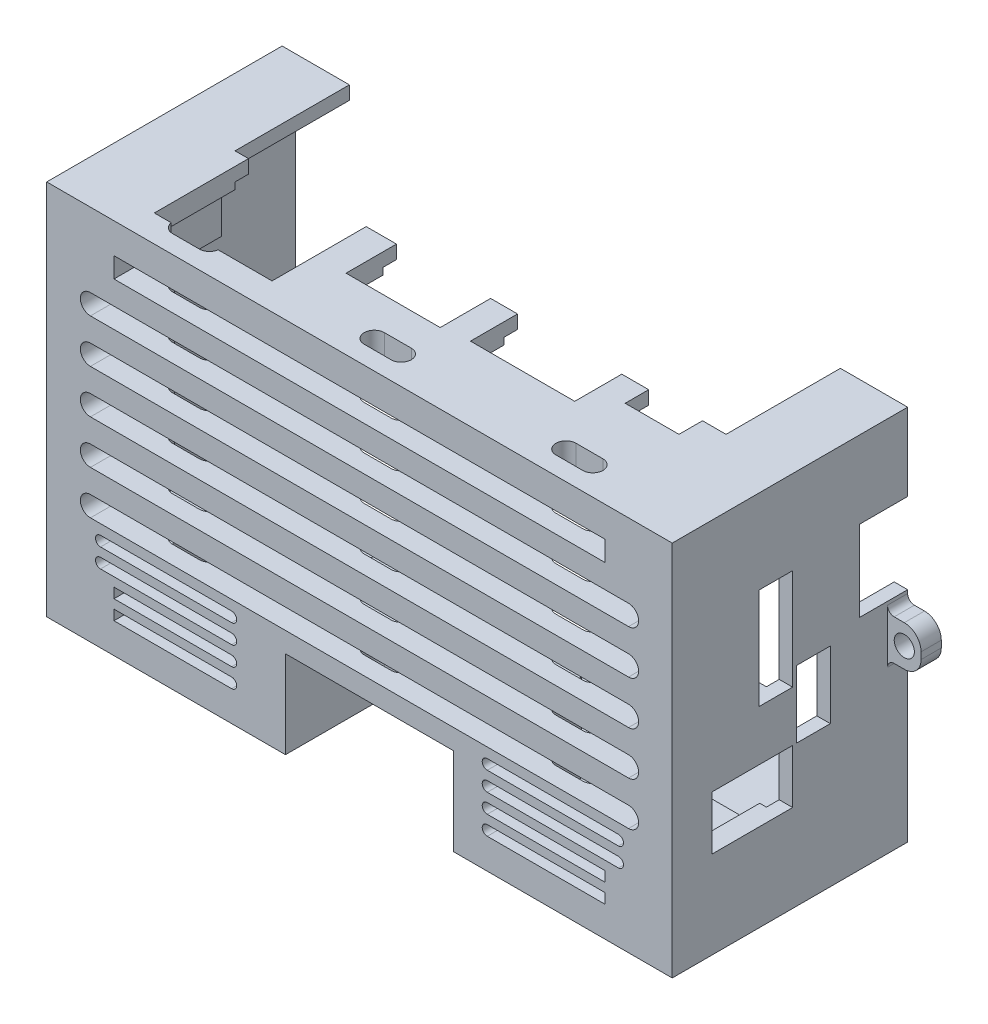
from build123d import *

# Parameters (mm, degrees)
EXTRUDE_1_DEPTH     = 35
CUT_EXTRUDE_1_DEPTH = 18
SKETCH_3_3_W        = 7
SKETCH_3_3_H        = 7
SKETCH_3_3_R        = 2
EXTRUDE_2_DEPTH     = 18
SKETCH_2_W          = 7
SKETCH_2_H          = 15.5
SKETCH_2_H_2        = 1.5
SKETCH_2_W_2        = 3
EXTRUDE_3_DEPTH     = 3
SKETCH_4_W          = 5
SKETCH_4_H          = 15
SKETCH_4_W_2        = 4
SKETCH_4_H_2        = 10
SKETCH_4_W_3        = 12
SKETCH_4_H_3        = 8
SKETCH_4_W_4        = 1
SKETCH_4_W_5        = 7.180640483
SKETCH_4_H_4        = 12
CUT_EXTRUDE_2_DEPTH = 3
CUT_EXTRUDE_START   = -16
SKETCH_3_5_W        = 7
SKETCH_3_5_H        = 7
SKETCH_3_5_R        = 2
CUT_EXTRUDE_3_DEPTH = 2
SKETCH_5_W          = 93
SKETCH_5_H          = 56
EXTRUDE_4_DEPTH     = 3
SKETCH_3_7_W        = 25
SKETCH_3_7_H        = 3
SKETCH_3_7_H_2      = 10
SKETCH_3_7_W_2      = 4
SKETCH_3_7_H_3      = 2.5
CUT_EXTRUDE_4_DEPTH = 18
SKETCH_6_W          = 73
SKETCH_6_H          = 3
CUT_EXTRUDE_5_DEPTH = 3
SKETCH_8_R          = 1.5
EXTRUDE_5_DEPTH     = 3
CUT_EXTRUDE_START_2 = -19
SKETCH_9_W          = 89
SKETCH_9_H          = 52
CUT_EXTRUDE_6_DEPTH = 19
CUT_EXTRUDE_7_DEPTH = 84.745149113
SKETCH_11_W         = 4
SKETCH_11_H         = 25
CUT_EXTRUDE_8_DEPTH = 6


with BuildPart() as part:
    # 草图1 → 凸台-拉伸1 (new body)
    with BuildSketch(Plane.XY):
        Polygon((-43.5, 18), (-46.5, 18), (-46.5, -18), (-43.5, -18), (-43.5, -17), (-43.5, 17), align=None)
        Polygon((-43.5, -18), (-46.5, -18), (-46.5, -28), (-36.5, -28), (-36.5, -25), (-43.5, -25), align=None)
        Polygon((46.5, -28), (46.5, -18), (43.5, -18), (43.5, -25), (36.5, -25), (36.5, -28), align=None)
        Polygon((46.5, -18), (46.5, 18), (43.5, 18), (43.5, 17), (43.5, -17), (43.5, -18), align=None)
        Polygon((-36.5, -25), (-36.5, -28), (36.5, -28), (36.5, -25), (35.5, -25), (23.25, -25), (-23.25, -25), (-35.5, -25), align=None)
        Polygon((-36.5, 28), (-46.5, 28), (-46.5, 18), (-43.5, 18), (-43.5, 25), (-36.5, 25), align=None)
        Polygon((46.5, 28), (36.5, 28), (36.5, 25), (43.5, 25), (43.5, 18), (46.5, 18), align=None)
    extrude(amount=EXTRUDE_1_DEPTH)

    # 草图3 → 切除-拉伸1 (cut)
    with BuildSketch(Plane.XY.offset(35)):
        Polygon((-46.5, -28), (-36.5, -28), (-36.5, -25), (-43.5, -25), (-43.5, -18), (-46.5, -18), align=None)
        Polygon((36.5, -25), (36.5, -28), (46.5, -28), (46.5, 18), (43.5, 18), (43.5, -25), align=None)
        Polygon((-43.5, 25), (-36.5, 25), (-36.5, 28), (-46.5, 28), (-46.5, 18), (-43.5, 18), align=None)
    extrude(amount=-CUT_EXTRUDE_1_DEPTH, mode=Mode.SUBTRACT)

    # 草图3<3> → 凸台-拉伸2 (add)
    # profile 1 of 9: a face of its own
    with BuildSketch(Plane.XY.offset(35)):
        with Locations((-40, 21.5)):
            Rectangle(SKETCH_3_3_W, SKETCH_3_3_H)
        with Locations((-39.5, 21)):
            Circle(SKETCH_3_3_R, mode=Mode.SUBTRACT)
    # profile 2 of 9: a face of its own
    with BuildSketch(Plane.XY.offset(35)):
        with Locations((-40, -21.5)):
            Rectangle(SKETCH_3_3_W, SKETCH_3_3_H)
        with Locations((-39.5, -21)):
            Circle(SKETCH_3_3_R, mode=Mode.SUBTRACT)
    # profile 3 of 9: a face of its own
    with BuildSketch(Plane.XY.offset(35)):
        with Locations((40, -21.5)):
            Rectangle(SKETCH_3_3_W, SKETCH_3_3_H)
        with Locations((39.5, -21)):
            Circle(SKETCH_3_3_R, mode=Mode.SUBTRACT)
    # profile 4 of 9: a face of its own
    with BuildSketch(Plane.XY.offset(35)):
        with Locations((40, 21.5)):
            Rectangle(SKETCH_3_3_W, SKETCH_3_3_H)
        with Locations((39.5, 21)):
            Circle(SKETCH_3_3_R, mode=Mode.SUBTRACT)
    # profile 5 of 9: a face of its own
    with BuildSketch(Plane.XY.offset(35)):
        Polygon((-46.5, -28), (-36.5, -28), (-36.5, -25), (-43.5, -25), (-43.5, -18), (-46.5, -18), align=None)
    # profile 6 of 9: a face of its own
    with BuildSketch(Plane.XY.offset(35)):
        Polygon((36.5, -25), (36.5, -28), (46.5, -28), (46.5, -18), (43.5, -18), (43.5, -25), align=None)
    # profile 7 of 9: a face of its own
    with BuildSketch(Plane.XY.offset(35)):
        Polygon((43.5, -18), (46.5, -18), (46.5, 18), (43.5, 18), (43.5, 17), (43.5, 15), (43.5, 1), (43.5, -7.5), (43.5, -14.5), (43.5, -17), align=None)
    # profile 8 of 9: a face of its own
    with BuildSketch(Plane.XY.offset(35)):
        Polygon((-43.5, 25), (-36.5, 25), (-36.5, 28), (-46.5, 28), (-46.5, 18), (-43.5, 18), align=None)
    # profile 9 of 9: a face of its own
    with BuildSketch(Plane.XY.offset(35)):
        Polygon((-11, -25), (-11, -15), (14, -15), (14, -25), (17, -25), (17, -12), (-14, -12), (-14, -25), align=None)
    extrude(amount=-EXTRUDE_2_DEPTH)

    # 草图2 → 凸台-拉伸3 (add)
    with BuildSketch(Plane(origin=(0, 28, 0), x_dir=(1, 0, 0), z_dir=(0, 1, 0))):
        Polygon((-43.5, -17), (-46.5, -17), (-46.5, -35), (36.5, -35), (36.5, -32.5), (-43.5, -32.5), align=None)
        Polygon((36.5, -32.5), (36.5, -17), (33, -17), (33, -20.5), (25, -20.5), (25, -17), (21, -17), (21, -24), (5.5, -24), (5.5, -17), (1.5, -17), (1.5, -24.5), (-12.5, -24.5), (-12.5, -17), (-17, -17), (-17, -31), (-34.5, -31), (-34.5, -17), (-43.5, -17), (-43.5, -32.5), align=None)
        Polygon((46.5, -35), (46.5, -17), (43.5, -17), (43.5, -32.5), (36.5, -32.5), (36.5, -35), align=None)
        with Locations((40, -24.75)):
            Rectangle(SKETCH_2_W, SKETCH_2_H)
        with Locations((40, -16.25)):
            Rectangle(SKETCH_2_W, SKETCH_2_H_2)
        with Locations((45, -16.25)):
            Rectangle(SKETCH_2_W_2, SKETCH_2_H_2)
        with Locations((-45, -16.25)):
            Rectangle(SKETCH_2_W_2, SKETCH_2_H_2)
    extrude(amount=-EXTRUDE_3_DEPTH)

    # 草图4 → 切除-拉伸2 (cut)
    with BuildSketch(Plane(origin=(46.5, 0, 0), x_dir=(0, 0, -1), z_dir=(1, 0, 0))):
        with Locations((-19.6, 8)):
            Rectangle(SKETCH_4_W, SKETCH_4_H)
        with Locations((-13.5, -2)):
            Rectangle(SKETCH_4_W_2, SKETCH_4_H_2)
        with Locations((-23.1, -11)):
            Rectangle(SKETCH_4_W_3, SKETCH_4_H_3)
        with Locations((-16, -2)):
            Rectangle(SKETCH_4_W_4, SKETCH_4_H_2)
        with Locations((-3.590320242, 10.5)):
            Rectangle(SKETCH_4_W_5, SKETCH_4_H_4)
    extrude(amount=-CUT_EXTRUDE_2_DEPTH, mode=Mode.SUBTRACT)

    # 草图3<5> → 切除-拉伸3 (cut)
    # profile 1 of 4: a face of its own
    with BuildSketch(Plane.XY.offset(35).offset(CUT_EXTRUDE_START)):
        with Locations((-40, 21.5)):
            Rectangle(SKETCH_3_5_W, SKETCH_3_5_H)
        with Locations((-39.5, 21)):
            Circle(SKETCH_3_5_R, mode=Mode.SUBTRACT)
    # profile 2 of 4: a face of its own
    with BuildSketch(Plane.XY.offset(35).offset(CUT_EXTRUDE_START)):
        with Locations((-40, -21.5)):
            Rectangle(SKETCH_3_5_W, SKETCH_3_5_H)
        with Locations((-39.5, -21)):
            Circle(SKETCH_3_5_R, mode=Mode.SUBTRACT)
    # profile 3 of 4: a face of its own
    with BuildSketch(Plane.XY.offset(35).offset(CUT_EXTRUDE_START)):
        with Locations((40, -21.5)):
            Rectangle(SKETCH_3_5_W, SKETCH_3_5_H)
        with Locations((39.5, -21)):
            Circle(SKETCH_3_5_R, mode=Mode.SUBTRACT)
    # profile 4 of 4: a face of its own
    with BuildSketch(Plane.XY.offset(35).offset(CUT_EXTRUDE_START)):
        with Locations((40, 21.5)):
            Rectangle(SKETCH_3_5_W, SKETCH_3_5_H)
        with Locations((39.5, 21)):
            Circle(SKETCH_3_5_R, mode=Mode.SUBTRACT)
    extrude(amount=-CUT_EXTRUDE_3_DEPTH, mode=Mode.SUBTRACT)

    # 草图5 → 凸台-拉伸4 (add)
    with BuildSketch(Plane.XY.offset(35)):
        Rectangle(SKETCH_5_W, SKETCH_5_H)
    extrude(amount=-EXTRUDE_4_DEPTH)

    # 草图3<7> → 切除-拉伸4 (cut)
    # profile 1 of 8: a face of its own
    with BuildSketch(Plane.XY.offset(35)):
        with Locations((1.5, -26.5)):
            Rectangle(SKETCH_3_7_W, SKETCH_3_7_H)
    # profile 2 of 8: a face of its own
    with BuildSketch(Plane.XY.offset(35)):
        with Locations((1.5, -20)):
            Rectangle(SKETCH_3_7_W, SKETCH_3_7_H_2)
        with Locations((-6.5, -22.25)):
            Rectangle(SKETCH_3_7_W_2, SKETCH_3_7_H_3, mode=Mode.SUBTRACT)
        with Locations((1.5, -22.25)):
            Rectangle(SKETCH_3_7_W_2, SKETCH_3_7_H_3, mode=Mode.SUBTRACT)
        with Locations((9.5, -22.25)):
            Rectangle(SKETCH_3_7_W_2, SKETCH_3_7_H_3, mode=Mode.SUBTRACT)
    # profile 3 of 8: a face of its own
    with BuildSketch(Plane.XY.offset(35)):
        with Locations((-6.5, -22.25)):
            Rectangle(SKETCH_3_7_W_2, SKETCH_3_7_H_3)
        with BuildLine():
            ThreePointArc((-5.5, -23), (-4.75, -22.25), (-5.5, -21.5))
            Line((-5.5, -21.5), (-7.5, -21.5))
            ThreePointArc((-7.5, -21.5), (-8.25, -22.25), (-7.5, -23))
            Line((-7.5, -23), (-5.5, -23))
        make_face(mode=Mode.SUBTRACT)
    # profile 4 of 8: a face of its own
    with BuildSketch(Plane.XY.offset(35)):
        with BuildLine():
            Line((-7.5, -23), (-5.5, -23))
            ThreePointArc((-5.5, -23), (-4.75, -22.25), (-5.5, -21.5))
            Line((-5.5, -21.5), (-7.5, -21.5))
            ThreePointArc((-7.5, -21.5), (-8.25, -22.25), (-7.5, -23))
        make_face()
    # profile 5 of 8: a face of its own
    with BuildSketch(Plane.XY.offset(35)):
        with Locations((1.5, -22.25)):
            Rectangle(SKETCH_3_7_W_2, SKETCH_3_7_H_3)
        with BuildLine():
            ThreePointArc((2.5, -23), (3.25, -22.25), (2.5, -21.5))
            Line((2.5, -21.5), (0.5, -21.5))
            ThreePointArc((0.5, -21.5), (-0.25, -22.25), (0.5, -23))
            Line((0.5, -23), (2.5, -23))
        make_face(mode=Mode.SUBTRACT)
    # profile 6 of 8: a face of its own
    with BuildSketch(Plane.XY.offset(35)):
        with BuildLine():
            Line((0.5, -23), (2.5, -23))
            ThreePointArc((2.5, -23), (3.25, -22.25), (2.5, -21.5))
            Line((2.5, -21.5), (0.5, -21.5))
            ThreePointArc((0.5, -21.5), (-0.25, -22.25), (0.5, -23))
        make_face()
    # profile 7 of 8: a face of its own
    with BuildSketch(Plane.XY.offset(35)):
        with Locations((9.5, -22.25)):
            Rectangle(SKETCH_3_7_W_2, SKETCH_3_7_H_3)
        with BuildLine():
            ThreePointArc((10.5, -23), (11.25, -22.25), (10.5, -21.5))
            Line((10.5, -21.5), (8.5, -21.5))
            ThreePointArc((8.5, -21.5), (7.75, -22.25), (8.5, -23))
            Line((8.5, -23), (10.5, -23))
        make_face(mode=Mode.SUBTRACT)
    # profile 8 of 8: a face of its own
    with BuildSketch(Plane.XY.offset(35)):
        with BuildLine():
            Line((8.5, -23), (10.5, -23))
            ThreePointArc((10.5, -23), (11.25, -22.25), (10.5, -21.5))
            Line((10.5, -21.5), (8.5, -21.5))
            ThreePointArc((8.5, -21.5), (7.75, -22.25), (8.5, -23))
        make_face()
    extrude(amount=-CUT_EXTRUDE_4_DEPTH, mode=Mode.SUBTRACT)

    # 草图6 → 切除-拉伸5 (cut)
    with BuildSketch(Plane.XY.offset(35)):
        with Locations((0, 22)):
            Rectangle(SKETCH_6_W, SKETCH_6_H)
        with BuildLine():
            Line((-19, -19.166666667), (-36.5, -19.166666667))
            Line((-36.5, -19.166666667), (-36.5, -20.666666667))
            Line((-36.5, -20.666666667), (-19, -20.666666667))
            ThreePointArc((-19, -20.666666667), (-18.25, -19.916666667), (-19, -19.166666667))
        make_face()
        with BuildLine():
            Line((-36.5, -22), (-36.5, -23.5))
            Line((-36.5, -23.5), (-19, -23.5))
            ThreePointArc((-19, -23.5), (-18.25, -22.75), (-19, -22))
            Line((-19, -22), (-36.5, -22))
        make_face()
        with BuildLine():
            Line((19, -23.5), (36.5, -23.5))
            Line((36.5, -23.5), (36.5, -22))
            Line((36.5, -22), (19, -22))
            ThreePointArc((19, -22), (18.25, -22.75), (19, -23.5))
        make_face()
        with BuildLine():
            Line((36.5, -20.666666667), (36.5, -19.166666667))
            Line((36.5, -19.166666667), (19, -19.166666667))
            ThreePointArc((19, -19.166666667), (18.25, -19.916666667), (19, -20.666666667))
            Line((19, -20.666666667), (36.5, -20.666666667))
        make_face()
        with BuildLine():
            Line((40, 17), (-40, 17))
            ThreePointArc((-40, 17), (-41.5, 15.5), (-40, 14))
            Line((-40, 14), (40, 14))
            ThreePointArc((40, 14), (41.5, 15.5), (40, 17))
        make_face()
        with BuildLine():
            Line((40, 10.5), (-40, 10.5))
            ThreePointArc((-40, 10.5), (-41.5, 9), (-40, 7.5))
            Line((-40, 7.5), (40, 7.5))
            ThreePointArc((40, 7.5), (41.5, 9), (40, 10.5))
        make_face()
        with BuildLine():
            Line((40, 4), (-40, 4))
            ThreePointArc((-40, 4), (-41.5, 2.5), (-40, 1))
            Line((-40, 1), (40, 1))
            ThreePointArc((40, 1), (41.5, 2.5), (40, 4))
        make_face()
        with BuildLine():
            Line((40, -2.5), (-40, -2.5))
            ThreePointArc((-40, -2.5), (-41.5, -4), (-40, -5.5))
            Line((-40, -5.5), (40, -5.5))
            ThreePointArc((40, -5.5), (41.5, -4), (40, -2.5))
        make_face()
        with BuildLine():
            Line((40, -9), (-40, -9))
            ThreePointArc((-40, -9), (-41.5, -10.5), (-40, -12))
            Line((-40, -12), (40, -12))
            ThreePointArc((40, -12), (41.5, -10.5), (40, -9))
        make_face()
        with BuildLine():
            Line((38.5, -13.5), (19, -13.5))
            ThreePointArc((19, -13.5), (18.25, -14.25), (19, -15))
            Line((19, -15), (38.5, -15))
            ThreePointArc((38.5, -15), (39.25, -14.25), (38.5, -13.5))
        make_face()
        with BuildLine():
            Line((38.5, -16.333333333), (19, -16.333333333))
            ThreePointArc((19, -16.333333333), (18.25, -17.083333333), (19, -17.833333333))
            Line((19, -17.833333333), (38.5, -17.833333333))
            ThreePointArc((38.5, -17.833333333), (39.25, -17.083333333), (38.5, -16.333333333))
        make_face()
        with BuildLine():
            ThreePointArc((-19, -17.833333333), (-18.25, -17.083333333), (-19, -16.333333333))
            Line((-19, -16.333333333), (-38.5, -16.333333333))
            ThreePointArc((-38.5, -16.333333333), (-39.25, -17.083333333), (-38.5, -17.833333333))
            Line((-38.5, -17.833333333), (-19, -17.833333333))
        make_face()
        with BuildLine():
            ThreePointArc((-19, -15), (-18.25, -14.25), (-19, -13.5))
            Line((-19, -13.5), (-38.5, -13.5))
            ThreePointArc((-38.5, -13.5), (-39.25, -14.25), (-38.5, -15))
            Line((-38.5, -15), (-19, -15))
        make_face()
    extrude(amount=-CUT_EXTRUDE_5_DEPTH, mode=Mode.SUBTRACT)

    # 草图8 → 凸台-拉伸5 (add)
    # profile 1 of 2: a face of its own
    with BuildSketch(Plane(origin=(0, 0, 0), x_dir=(-1, 0, 0), z_dir=(0, 0, -1))):
        with BuildLine():
            ThreePointArc((47.5, 3), (46.792893219, 3.292893219), (46.5, 4))
            Line((46.5, 4), (46.5, 3))
            Line((46.5, 3), (46.5, -3))
            Line((46.5, -3), (46.5, -4))
            ThreePointArc((46.5, -4), (46.792893219, -3.292893219), (47.5, -3))
            Line((47.5, -3), (47.899019222, -3))
            Line((47.899019222, -3), (49, -3))
            ThreePointArc((49, -3), (50.767766953, -2.267766953), (51.5, -0.5))
            Line((51.5, -0.5), (51.5, 0.5))
            ThreePointArc((51.5, 0.5), (50.767766953, 2.267766953), (49, 3))
            Line((49, 3), (47.899019222, 3))
            Line((47.899019222, 3), (47.5, 3))
        make_face()
        with Locations((49, 0)):
            Circle(SKETCH_8_R, mode=Mode.SUBTRACT)
    # profile 2 of 2: a face of its own
    with BuildSketch(Plane(origin=(0, 0, 0), x_dir=(-1, 0, 0), z_dir=(0, 0, -1))):
        with BuildLine():
            Line((-46.5, 3), (-46.5, 4))
            ThreePointArc((-46.5, 4), (-46.792893219, 3.292893219), (-47.5, 3))
            Line((-47.5, 3), (-47.899019222, 3))
            Line((-47.899019222, 3), (-49, 3))
            ThreePointArc((-49, 3), (-50.767766953, 2.267766953), (-51.5, 0.5))
            Line((-51.5, 0.5), (-51.5, -0.5))
            ThreePointArc((-51.5, -0.5), (-50.767766953, -2.267766953), (-49, -3))
            Line((-49, -3), (-47.899019222, -3))
            Line((-47.899019222, -3), (-47.5, -3))
            ThreePointArc((-47.5, -3), (-46.792893219, -3.292893219), (-46.5, -4))
            Line((-46.5, -4), (-46.5, -3))
            Line((-46.5, -3), (-46.5, 3))
        make_face()
        with Locations((-49, 0)):
            Circle(SKETCH_8_R, mode=Mode.SUBTRACT)
    extrude(amount=-EXTRUDE_5_DEPTH)

    # 草图9 → 切除-拉伸6 (cut)
    with BuildSketch(Plane(origin=(0, 0, 0), x_dir=(-1, 0, 0), z_dir=(0, 0, -1)).offset(CUT_EXTRUDE_START_2)):
        Rectangle(SKETCH_9_W, SKETCH_9_H)
    extrude(amount=CUT_EXTRUDE_6_DEPTH, mode=Mode.SUBTRACT)

    # 草图10 → 切除-拉伸7 (cut, through all)
    with BuildSketch(Plane(origin=(0, 28, 0), x_dir=(1, 0, 0), z_dir=(0, 1, 0))):
        with BuildLine():
            Line((-30.5, -32.299897015), (-26.5, -32.299897015))
            ThreePointArc((-26.5, -32.299897015), (-25, -30.799897015), (-26.5, -29.299897015))
            Line((-26.5, -29.299897015), (-30.5, -29.299897015))
            ThreePointArc((-30.5, -29.299897015), (-32, -30.799897015), (-30.5, -32.299897015))
        make_face()
        with BuildLine():
            Line((-2, -32.299897015), (2, -32.299897015))
            ThreePointArc((2, -32.299897015), (3.5, -30.799897015), (2, -29.299897015))
            Line((2, -29.299897015), (-2, -29.299897015))
            ThreePointArc((-2, -29.299897015), (-3.5, -30.799897015), (-2, -32.299897015))
        make_face()
        with BuildLine():
            Line((26.5, -32.299897015), (30.5, -32.299897015))
            ThreePointArc((30.5, -32.299897015), (32, -30.799897015), (30.5, -29.299897015))
            Line((30.5, -29.299897015), (26.5, -29.299897015))
            ThreePointArc((26.5, -29.299897015), (25, -30.799897015), (26.5, -32.299897015))
        make_face()
        with BuildLine():
            Line((-25.013406984, -31), (-31.986593016, -31))
            ThreePointArc((-31.986593016, -31), (-31.487381771, -31.929090196), (-30.5, -32.299897015))
            Line((-30.5, -32.299897015), (-26.5, -32.299897015))
            ThreePointArc((-26.5, -32.299897015), (-25.512618229, -31.929090196), (-25.013406984, -31))
        make_face()
    extrude(amount=-CUT_EXTRUDE_7_DEPTH, mode=Mode.SUBTRACT)

    # 草图11 → 切除-拉伸8 (cut)
    with BuildSketch(Plane.ZY.offset(46.5)):
        with Locations((27, 4.5)):
            Rectangle(SKETCH_11_W, SKETCH_11_H)
    extrude(amount=-CUT_EXTRUDE_8_DEPTH, mode=Mode.SUBTRACT)


solid = part.part
